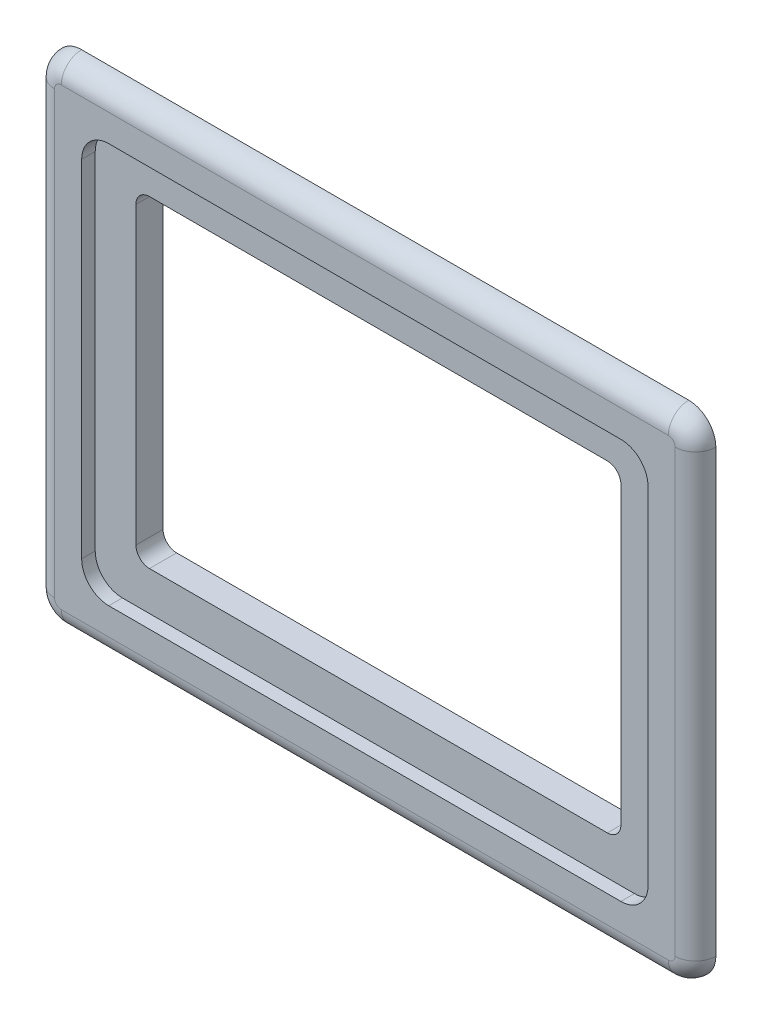
from build123d import *

# Parameters (mm, degrees)
SKETCH1_W           = 309.5625
SKETCH1_H           = 231.775
SKETCH1_W_2         = 265.1125
SKETCH1_H_2         = 187.325
SKETCH1_W_3         = 227.0125
SKETCH1_H_3         = 150.8125
BOSS_EXTRUDE1_DEPTH = 9.525
SKETCH1_3_W         = 265.1125
SKETCH1_3_H         = 187.325
SKETCH1_3_W_2       = 227.0125
SKETCH1_3_H_2       = 150.8125
BOSS_EXTRUDE2_DEPTH = 9.525
FILLET1_R           = 12.7
CUT_EXTRUDE1_START  = 9.525
SKETCH1_4_W         = 265.1125
SKETCH1_4_H         = 187.325
SKETCH1_4_W_2       = 227.0125
SKETCH1_4_H_2       = 150.8125
CUT_EXTRUDE1_DEPTH  = 6.35
FILLET2_R           = 6.35
FILLET3_R           = 12.7
FILLET4_R           = 9.525


with BuildPart() as part:
    # Sketch1 → Boss-Extrude1 (new body)
    # profile 1 of 2: a face of its own
    with BuildSketch(Plane.XY):
        Rectangle(SKETCH1_W, SKETCH1_H)
        Rectangle(SKETCH1_W_2, SKETCH1_H_2, mode=Mode.SUBTRACT)
    # profile 2 of 2: a face of its own
    with BuildSketch(Plane.XY):
        Rectangle(SKETCH1_W_2, SKETCH1_H_2)
        Rectangle(SKETCH1_W_3, SKETCH1_H_3, mode=Mode.SUBTRACT)
    extrude(amount=BOSS_EXTRUDE1_DEPTH)

    # Sketch1<3> → Boss-Extrude2 (add)
    with BuildSketch(Plane.XY):
        Rectangle(SKETCH1_3_W, SKETCH1_3_H)
        Rectangle(SKETCH1_3_W_2, SKETCH1_3_H_2, mode=Mode.SUBTRACT)
    extrude(amount=-BOSS_EXTRUDE2_DEPTH)

    # Fillet1
    fillet1_edges = [part.edges().sort_by_distance(p)[0] for p in [
        (-154.78125, -115.8875, 4.7625),
        (-154.78125, 115.8875, 4.7625),
        (154.78125, 115.8875, 4.7625),
        (154.78125, -115.8875, 4.7625),
        (132.55625, -93.6625, -4.7625),
        (-132.55625, -93.6625, -4.7625),
        (-132.55625, 93.6625, -4.7625),
        (132.55625, 93.6625, -4.7625),
    ]]
    fillet(fillet1_edges, radius=FILLET1_R)

    # Sketch1<4> → Cut-Extrude1 (cut)
    with BuildSketch(Plane.XY.offset(CUT_EXTRUDE1_START)):
        Rectangle(SKETCH1_4_W, SKETCH1_4_H)
        Rectangle(SKETCH1_4_W_2, SKETCH1_4_H_2, mode=Mode.SUBTRACT)
    extrude(amount=-CUT_EXTRUDE1_DEPTH, mode=Mode.SUBTRACT)

    # Fillet2
    fillet2_edges = [part.edges().sort_by_distance(p)[0] for p in [
        (-113.50625, 75.40625, -3.175),
        (113.50625, 75.40625, -3.175),
        (-113.50625, -75.40625, -3.175),
        (113.50625, -75.40625, -3.175),
    ]]
    fillet(fillet2_edges, radius=FILLET2_R)

    # Fillet3
    fillet3_edges = [part.edges().sort_by_distance(p)[0] for p in [
        (-132.55625, -93.6625, 6.35),
        (-132.55625, 93.6625, 6.35),
        (132.55625, 93.6625, 6.35),
        (132.55625, -93.6625, 6.35),
    ]]
    fillet(fillet3_edges, radius=FILLET3_R)

    # Fillet4
    fillet4_edges = [part.edges().sort_by_distance(p)[0] for p in [
        (-151.061506121, -112.167756121, 9.525),
        (0, -115.8875, 9.525),
        (151.061506121, -112.167756121, 9.525),
        (154.78125, 0, 9.525),
        (151.061506121, 112.167756121, 9.525),
        (0, 115.8875, 9.525),
        (-151.061506121, 112.167756121, 9.525),
        (-154.78125, 0, 9.525),
    ]]
    fillet(fillet4_edges, radius=FILLET4_R - 0.0001)  # a hair under: the kernel refuses the full size


solid = part.part
